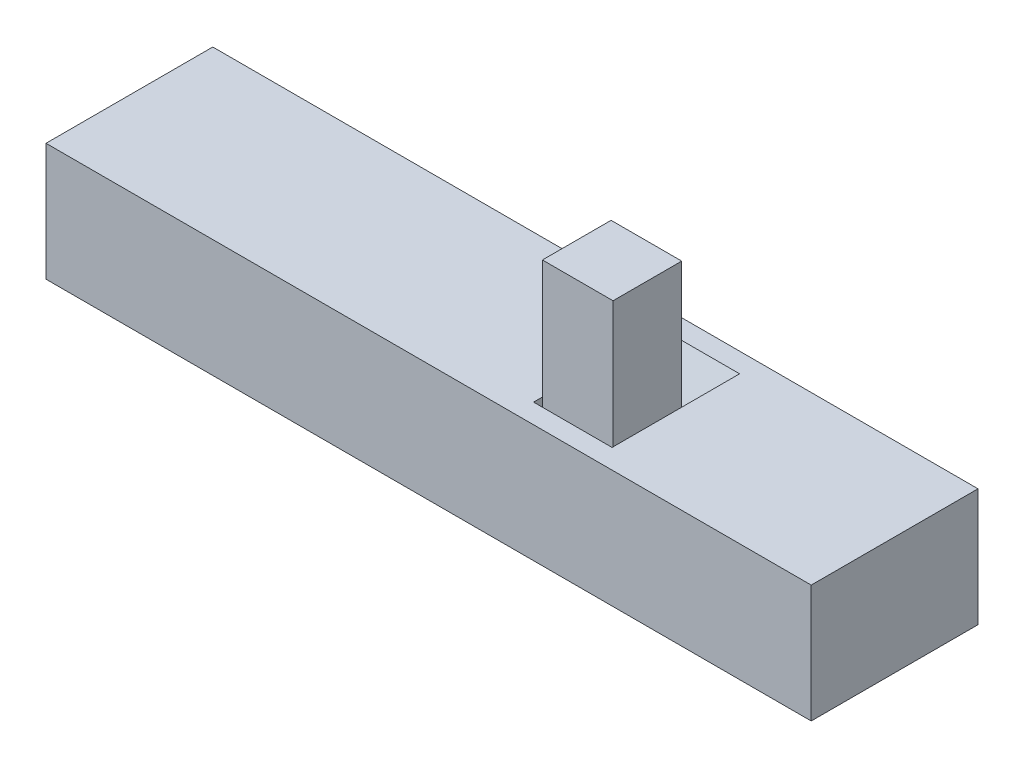
from build123d import *

# Parameters (mm, degrees)
SKETCH1_W                = 39
SKETCH1_H                = 8.5
BOSS_EXTRUDE1_DEPTH      = 6
SKETCH2_W                = 4
SKETCH2_H                = 4
CUT_EXTRUDE1_DEPTH       = 5
CUT_EXTRUDE2_DEPTH       = 8
CUT_EXTRUDE2_DEPTH_BACK  = 4
SKETCH3_R                = 1.5
BOSS_EXTRUDE2_START      = 0.2
SKETCH4_W                = 3.5
SKETCH4_H                = 6.25
SKETCH4_H_2              = 0.75
SKETCH4_R                = 1.5
SKETCH4_R_2              = 1.3
BOSS_EXTRUDE2_DEPTH      = 3.6
BOSS_EXTRUDE3_DEPTH      = 7.6
BOSS_EXTRUDE3_DEPTH_BACK = 3.6
SKETCH4_3_R              = 1.3
FILLET1_R                = 1.75
CUT_EXTRUDE3_DEPTH       = 4


with BuildPart() as part:
    # Sketch1 → Boss-Extrude1 (new body)
    with BuildSketch(Plane(origin=(0, 0, 0), x_dir=(1, 0, 0), z_dir=(0, 1, 0))):
        with Locations((19.5, 4.25)):
            Rectangle(SKETCH1_W, SKETCH1_H)
    extrude(amount=BOSS_EXTRUDE1_DEPTH)

    # Sketch2 → Cut-Extrude1 (cut)
    with BuildSketch(Plane(origin=(0, 6, 0), x_dir=(1, 0, 0), z_dir=(0, 1, 0))):
        with Locations((25.85, 3)):
            Rectangle(SKETCH2_W, SKETCH2_H)
    extrude(amount=-CUT_EXTRUDE1_DEPTH, mode=Mode.SUBTRACT)

    # Sketch3 → Cut-Extrude2 (cut, two sides: drawn at the far end of the back side and taken through both)
    with BuildSketch(Plane.ZY.offset(-27.85).offset(-CUT_EXTRUDE2_DEPTH_BACK)):
        with Locations(Location((-3, 3.5, 0), (0, 0, 180))):
            Circle(SKETCH3_R)
    extrude(amount=CUT_EXTRUDE2_DEPTH + CUT_EXTRUDE2_DEPTH_BACK, mode=Mode.SUBTRACT)

    # Sketch5 → Cut-Extrude3 (cut)
    with BuildSketch(Plane.ZY.offset(-27.85)):
        Polygon((-5, 6), (-7.5, 6), (-5, 1), align=None)
    extrude(amount=CUT_EXTRUDE3_DEPTH, mode=Mode.SUBTRACT)


with BuildPart() as body_2:
    # Sketch4 → Boss-Extrude2 (new body)
    # profile 1 of 5: a face of its own
    with BuildSketch(Plane.ZY.offset(-27.85).offset(BOSS_EXTRUDE2_START)):
        with Locations((-3, 9.125)):
            Rectangle(SKETCH4_W, SKETCH4_H)
    # profile 2 of 5: a face of its own
    with BuildSketch(Plane.ZY.offset(-27.85).offset(BOSS_EXTRUDE2_START)):
        with Locations((-3, 5.625)):
            Rectangle(SKETCH4_W, SKETCH4_H_2)
    # profile 3 of 5: a face of its own
    with BuildSketch(Plane.ZY.offset(-27.85).offset(BOSS_EXTRUDE2_START)):
        with BuildLine():
            Line((-4.75, 1.75), (-3, 1.75))
            ThreePointArc((-3, 1.75), (-1.762563133, 2.262563133), (-1.25, 3.5))
            Line((-1.25, 3.5), (-1.25, 5.25))
            Line((-1.25, 5.25), (-4.75, 5.25))
            Line((-4.75, 5.25), (-4.75, 1.75))
        make_face()
        with Locations(Location((-3, 3.5, 0), (0, 0, 180))):
            Circle(SKETCH4_R, mode=Mode.SUBTRACT)
    # profile 4 of 5: a face of its own
    with BuildSketch(Plane.ZY.offset(-27.85).offset(BOSS_EXTRUDE2_START)):
        with Locations(Location((-3, 3.5, 0), (0, 0, 180))):
            Circle(SKETCH4_R)
        with Locations((-3, 3.5)):
            Circle(SKETCH4_R_2, mode=Mode.SUBTRACT)
    # profile 5 of 5: a face of its own
    with BuildSketch(Plane.ZY.offset(-27.85).offset(BOSS_EXTRUDE2_START)):
        with Locations((-3, 3.5)):
            Circle(SKETCH4_R_2)
    extrude(amount=BOSS_EXTRUDE2_DEPTH)

    # Sketch4<3> → Boss-Extrude3 (add, two sides: drawn at the far end of the back side and taken through both)
    with BuildSketch(Plane.ZY.offset(-27.85).offset(-BOSS_EXTRUDE3_DEPTH_BACK)):
        with Locations((-3, 3.5)):
            Circle(SKETCH4_3_R)
    extrude(amount=BOSS_EXTRUDE3_DEPTH + BOSS_EXTRUDE3_DEPTH_BACK)

    # Fillet1
    fillet1_edges = [body_2.edges().sort_by_distance(p)[0] for p in [
        (25.85, 1.75, -4.75),
    ]]
    fillet(fillet1_edges, radius=FILLET1_R - 0.0001)  # a hair under: the kernel refuses the full size


solid = Compound([part.part, body_2.part])
